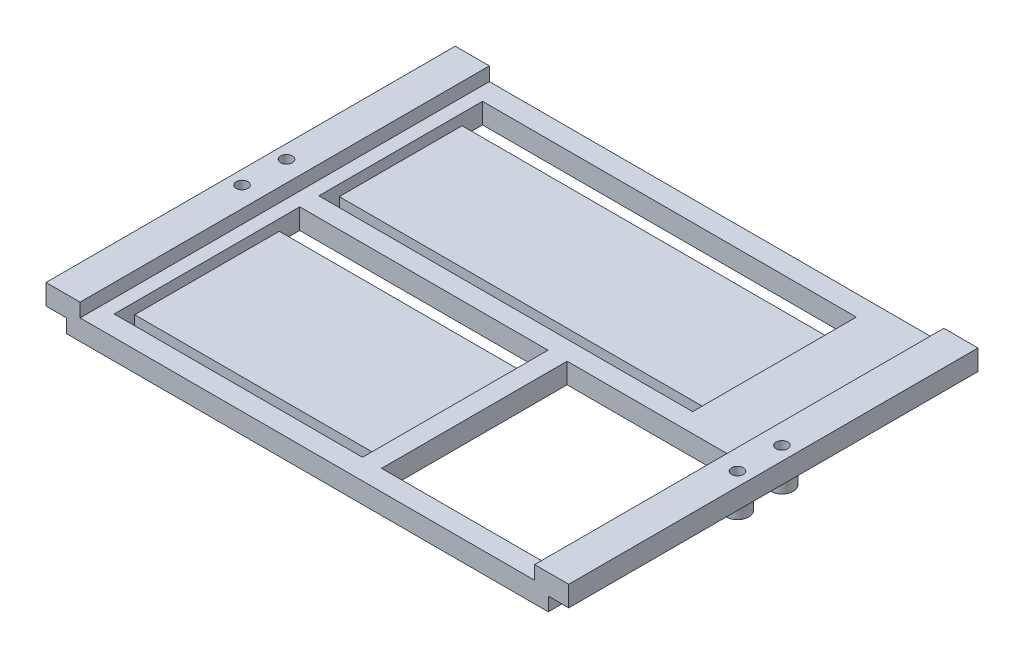
from build123d import *

# Parameters (mm, degrees)
PLATEFRAME_DEPTH          = 150
SKETCH3_R                 = 2.15
HOLESUPPORT_DEPTH         = 7.5
SKETCH4_R                 = 4.15
SKETCH4_R_2               = 2.15
CYLINDRICALSUPPORTS_DEPTH = 12.5
SKETCH8_W                 = 137
SKETCH8_H                 = 60
SKETCH8_W_2               = 91
SKETCH8_H_2               = 68
ITEMLAYOUT_DEPTH          = 4
SKETCH9_W                 = 58.6
SKETCH9_H                 = 68
HOLECUTOUT_DEPTH          = 7.5
SKETCH10_W                = 91
SKETCH10_H                = 7.5
SKETCH10_W_2              = 137
VELCROCUT_DEPTH           = 3.5


with BuildPart() as part:
    # Sketch2 → PlateFrame (new body)
    with BuildSketch(Plane.XY):
        Polygon((179.1, 12.5), (191.6, 12.5), (191.6, 5), (184.1, 5), (184.1, 0), (7.5, 0), (7.5, 5), (0, 5), (0, 12.5), (12.5, 12.5), (12.5, 7.5), (179.1, 7.5), align=None)
    extrude(amount=PLATEFRAME_DEPTH)

    # Sketch3 → HoleSupport (cut)
    with BuildSketch(Plane(origin=(0, 12.5, 0), x_dir=(1, 0, 0), z_dir=(0, 1, 0))):
        with Locations((5, -66.85)):
            Circle(SKETCH3_R)
        with Locations((5, -83.15)):
            Circle(SKETCH3_R)
        with Locations((186.6, -66.85)):
            Circle(SKETCH3_R)
        with Locations((186.6, -83.15)):
            Circle(SKETCH3_R)
    extrude(amount=-HOLESUPPORT_DEPTH, mode=Mode.SUBTRACT)

    # Sketch4 → CylindricalSupports (add)
    # profile 1 of 4: a face of its own
    with BuildSketch(Plane(origin=(0, 12.5, 0), x_dir=(1, 0, 0), z_dir=(0, 1, 0))):
        with Locations((186.6, -66.85)):
            Circle(SKETCH4_R)
        with Locations((186.6, -66.85)):
            Circle(SKETCH4_R_2, mode=Mode.SUBTRACT)
    # profile 2 of 4: a face of its own
    with BuildSketch(Plane(origin=(0, 12.5, 0), x_dir=(1, 0, 0), z_dir=(0, 1, 0))):
        with Locations((186.6, -83.15)):
            Circle(SKETCH4_R)
        with Locations((186.6, -83.15)):
            Circle(SKETCH4_R_2, mode=Mode.SUBTRACT)
    # profile 3 of 4: a face of its own
    with BuildSketch(Plane(origin=(0, 12.5, 0), x_dir=(1, 0, 0), z_dir=(0, 1, 0))):
        with Locations((5, -66.85)):
            Circle(SKETCH4_R)
        with Locations((5, -66.85)):
            Circle(SKETCH4_R_2, mode=Mode.SUBTRACT)
    # profile 4 of 4: a face of its own
    with BuildSketch(Plane(origin=(0, 12.5, 0), x_dir=(1, 0, 0), z_dir=(0, 1, 0))):
        with Locations((5, -83.15)):
            Circle(SKETCH4_R)
        with Locations((5, -83.15)):
            Circle(SKETCH4_R_2, mode=Mode.SUBTRACT)
    extrude(amount=-CYLINDRICALSUPPORTS_DEPTH)

    # Sketch8 → ItemLayout (cut)
    with BuildSketch(Plane(origin=(0, 7.5, 0), x_dir=(1, 0, 0), z_dir=(0, 1, 0))):
        with Locations((86, -37.5)):
            Rectangle(SKETCH8_W, SKETCH8_H)
        with Locations((63, -108.5)):
            Rectangle(SKETCH8_W_2, SKETCH8_H_2)
    extrude(amount=-ITEMLAYOUT_DEPTH, mode=Mode.SUBTRACT)

    # Sketch9 → HoleCutout (cut)
    with BuildSketch(Plane(origin=(0, 7.5, 0), x_dir=(1, 0, 0), z_dir=(0, 1, 0))):
        with Locations((144.8, -108.5)):
            Rectangle(SKETCH9_W, SKETCH9_H)
    extrude(amount=-HOLECUTOUT_DEPTH, mode=Mode.SUBTRACT)

    # Sketch10 → VelcroCut (cut)
    with BuildSketch(Plane(origin=(0, 3.5, 0), x_dir=(1, 0, 0), z_dir=(0, 1, 0))):
        with Locations((63, -78.25)):
            Rectangle(SKETCH10_W, SKETCH10_H)
        with Locations((63, -138.75)):
            Rectangle(SKETCH10_W, SKETCH10_H)
        with Locations((86, -11.25)):
            Rectangle(SKETCH10_W_2, SKETCH10_H)
        with Locations((86, -63.75)):
            Rectangle(SKETCH10_W_2, SKETCH10_H)
    extrude(amount=-VELCROCUT_DEPTH, mode=Mode.SUBTRACT)


solid = part.part
